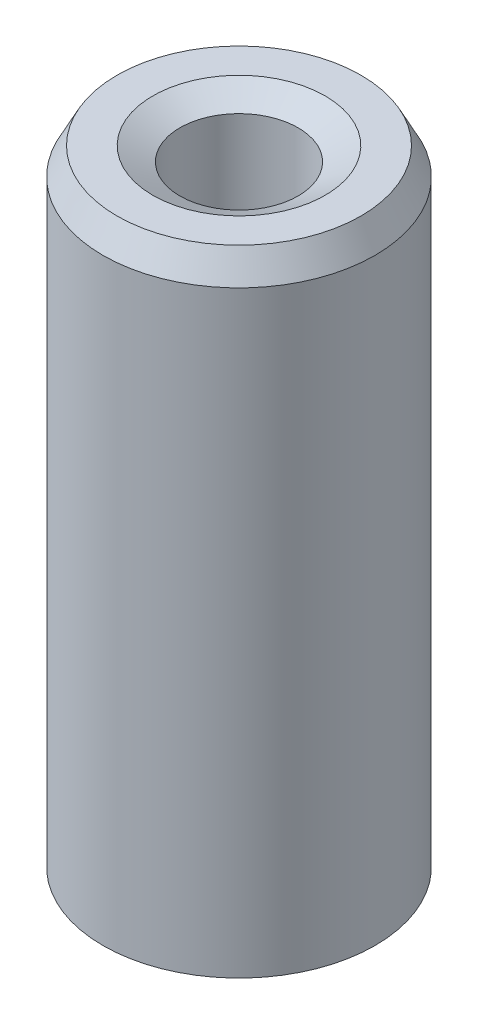
from build123d import *
from OCP.BRepFilletAPI import BRepFilletAPI_MakeChamfer

# Parameters (mm, degrees)
SKETCH1_R           = 15
BOSS_EXTRUDE1_DEPTH = 70.42781312
SKETCH2_R           = 6.517781145
CUT_EXTRUDE1_DEPTH  = 74.553224681
CHAMFER1_SIZE       = 2.980106596
CHAMFER1_SIZE2      = 1.553156568


with BuildPart() as part:
    # Sketch1 → Boss-Extrude1 (new body)
    with BuildSketch(Plane(origin=(0, 0, 0), x_dir=(1, 0, 0), z_dir=(0, 1, 0))):
        Circle(SKETCH1_R)
    extrude(amount=BOSS_EXTRUDE1_DEPTH)

    # Sketch2 → Cut-Extrude1 (cut, through all)
    with BuildSketch(Plane(origin=(0, 0, 0), x_dir=(1, 0, 0), z_dir=(0, 1, 0))):
        Circle(SKETCH2_R)
    extrude(amount=CUT_EXTRUDE1_DEPTH, mode=Mode.SUBTRACT)

    # Chamfer1: one chamfer whose edges measure the first distance from different faces: ONE call of the kernel's chamfer builder (chamfer() names one face for all edges)
    chamfer1_edges_1 = [part.edges().sort_by_distance(p)[0] for p in [
        (-6.517781145, 70.42781312, 0),
    ]]
    chamfer1_side_1 = [part.faces().sort_by_distance(p)[0] for p in [
        (-14.575735931, 70.42781312, 0),
    ]]
    chamfer1_edges_2 = [part.edges().sort_by_distance(p)[0] for p in [
        (-6.517781145, 0, 0),
    ]]
    chamfer1_side_2 = [part.faces().sort_by_distance(p)[0] for p in [
        (-6.517781145, 35.21390656, 0),
    ]]
    chamfer1_edges_3 = [part.edges().sort_by_distance(p)[0] for p in [
        (-15, 0, 0),
    ]]
    chamfer1_side_3 = [part.faces().sort_by_distance(p)[0] for p in [
        (-14.575735931, 0, 0),
    ]]
    chamfer1_edges_4 = [part.edges().sort_by_distance(p)[0] for p in [
        (-15, 70.42781312, 0),
    ]]
    chamfer1_side_4 = [part.faces().sort_by_distance(p)[0] for p in [
        (-15, 35.21390656, 0),
    ]]
    chamfer1 = BRepFilletAPI_MakeChamfer(part.part.solid().wrapped)
    for e in chamfer1_edges_1:
        chamfer1.Add(CHAMFER1_SIZE, CHAMFER1_SIZE2, e.wrapped, chamfer1_side_1[0].wrapped)  # the first distance lies on this face
    for e in chamfer1_edges_2:
        chamfer1.Add(CHAMFER1_SIZE, CHAMFER1_SIZE2, e.wrapped, chamfer1_side_2[0].wrapped)  # the first distance lies on this face
    for e in chamfer1_edges_3:
        chamfer1.Add(CHAMFER1_SIZE, CHAMFER1_SIZE2, e.wrapped, chamfer1_side_3[0].wrapped)  # the first distance lies on this face
    for e in chamfer1_edges_4:
        chamfer1.Add(CHAMFER1_SIZE, CHAMFER1_SIZE2, e.wrapped, chamfer1_side_4[0].wrapped)  # the first distance lies on this face
    add(Compound.cast(chamfer1.Shape()), mode=Mode.REPLACE)


solid = part.part
